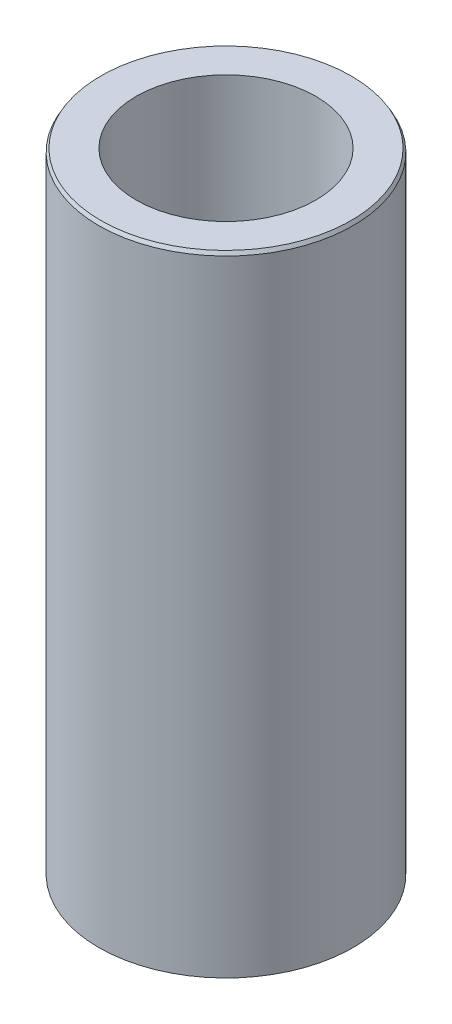
from build123d import *
from OCP.BRepFilletAPI import BRepFilletAPI_MakeChamfer

# Parameters (mm, degrees)
SKETCH1_R           = 50
BOSS_EXTRUDE1_DEPTH = 247.905329003
SKETCH2_R           = 35.326513973
CUT_EXTRUDE1_DEPTH  = 258.792653402
CHAMFER1_SIZE       = 1.363758559
CHAMFER1_SIZE2      = 0.787366371


with BuildPart() as part:
    # Sketch1 → Boss-Extrude1 (new body)
    with BuildSketch(Plane(origin=(0, 0, 0), x_dir=(1, 0, 0), z_dir=(0, 1, 0))):
        Circle(SKETCH1_R)
    extrude(amount=BOSS_EXTRUDE1_DEPTH)

    # Sketch2 → Cut-Extrude1 (cut, through all)
    with BuildSketch(Plane(origin=(0, 0, 0), x_dir=(1, 0, 0), z_dir=(0, 1, 0))):
        Circle(SKETCH2_R)
    extrude(amount=CUT_EXTRUDE1_DEPTH, mode=Mode.SUBTRACT)

    # Chamfer1: one chamfer whose edges measure the first distance from different faces: ONE call of the kernel's chamfer builder (chamfer() names one face for all edges)
    chamfer1_edges_1 = [part.edges().sort_by_distance(p)[0] for p in [
        (-50, 247.905329003, 0),
    ]]
    chamfer1_side_1 = [part.faces().sort_by_distance(p)[0] for p in [
        (-50, 123.952664501, 0),
    ]]
    chamfer1_edges_2 = [part.edges().sort_by_distance(p)[0] for p in [
        (-50, 0, 0),
    ]]
    chamfer1_side_2 = [part.faces().sort_by_distance(p)[0] for p in [
        (-48.585786438, 0, 0),
    ]]
    chamfer1 = BRepFilletAPI_MakeChamfer(part.part.solid().wrapped)
    for e in chamfer1_edges_1:
        chamfer1.Add(CHAMFER1_SIZE, CHAMFER1_SIZE2, e.wrapped, chamfer1_side_1[0].wrapped)  # the first distance lies on this face
    for e in chamfer1_edges_2:
        chamfer1.Add(CHAMFER1_SIZE, CHAMFER1_SIZE2, e.wrapped, chamfer1_side_2[0].wrapped)  # the first distance lies on this face
    add(Compound.cast(chamfer1.Shape()), mode=Mode.REPLACE)


solid = part.part
